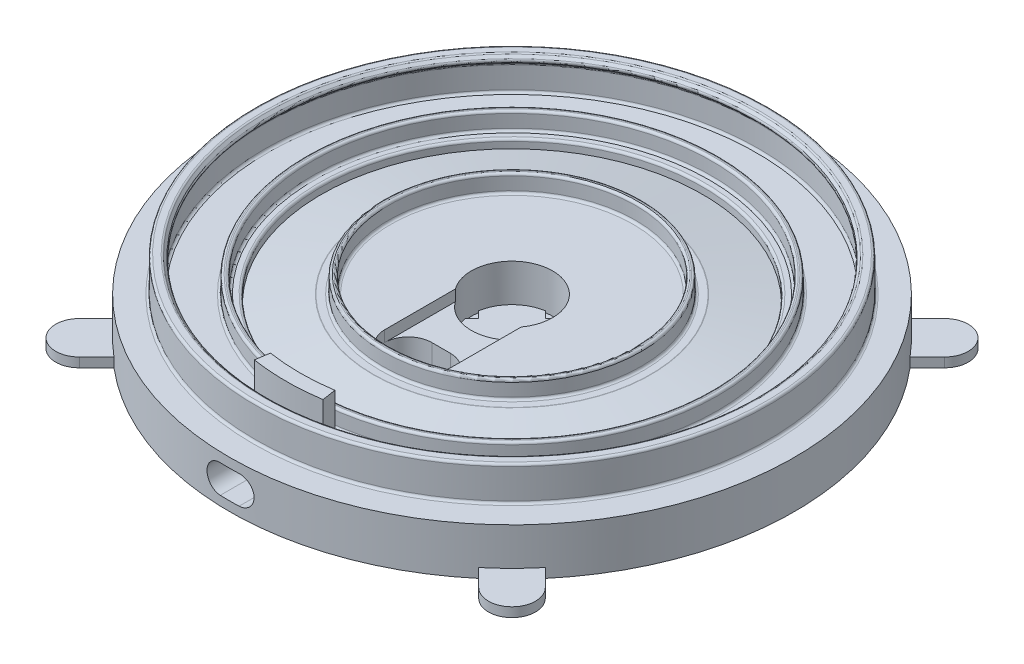
from build123d import *

# Parameters (mm, degrees)
SKETCH1_R               = 60
BOSS_EXTRUDE1_DEPTH     = 10
SKETCH3_R               = 43.75
SKETCH3_R_2             = 42.5
SKETCH3_R_3             = 27.5
SKETCH3_R_4             = 26.25
BOSS_EXTRUDE2_DEPTH     = 3.723
FILLET1_R               = 0.5
FILLET2_R               = 0.5
SKETCH6_R               = 8.625
CUT_EXTRUDE1_DEPTH      = 8.354
SKETCH9_W               = 14
SKETCH9_H               = 15
CUT_EXTRUDE2_DEPTH      = 2.354
CUT_EXTRUDE3_DEPTH      = 10
CUT_EXTRUDE4_DEPTH      = 2
CUT_EXTRUDE4_DEPTH_BACK = 40
BOSS_EXTRUDE3_DEPTH     = 2
BOSS_EXTRUDE4_DEPTH     = 8


with BuildPart() as part:
    # Sketch1 → Boss-Extrude1 (new body)
    with BuildSketch(Plane(origin=(0, 0, 0), x_dir=(1, 0, 0), z_dir=(0, 1, 0))):
        Circle(SKETCH1_R)
    extrude(amount=BOSS_EXTRUDE1_DEPTH)

    # Sketch2 → Cut-Revolve1 (revolve, cut)
    with BuildSketch(Plane.XY):
        Polygon((-29.5, 10), (-40.5, 8.127), (-40.5, 10), align=None)
    revolve(axis=Axis((0, 10, 0), (0, -1, 0)), mode=Mode.SUBTRACT)

    # Sketch3 → Boss-Extrude2 (add)
    # profile 1 of 2: a face of its own
    with BuildSketch(Plane(origin=(0, 10, 0), x_dir=(1, 0, 0), z_dir=(0, 1, 0))):
        Circle(SKETCH3_R)
        Circle(SKETCH3_R_2, mode=Mode.SUBTRACT)
    # profile 2 of 2: a face of its own
    with BuildSketch(Plane(origin=(0, 10, 0), x_dir=(1, 0, 0), z_dir=(0, 1, 0))):
        Circle(SKETCH3_R_3)
        Circle(SKETCH3_R_4, mode=Mode.SUBTRACT)
    extrude(amount=BOSS_EXTRUDE2_DEPTH)

    # Fillet1
    fillet1_edges = [part.edges().sort_by_distance(p)[0] for p in [
        (-26.25, 10, 0),
        (-27.5, 10, 0),
        (-43.75, 10, 0),
        (-42.5, 10, 0),
        (40.5, 10, 0),
        (-27.5, 13.723, 0),
        (-26.25, 13.723, 0),
        (-43.75, 13.723, 0),
        (-42.5, 13.723, 0),
        (29.5, 10, 0),
    ]]
    fillet(fillet1_edges, radius=FILLET1_R)

    # Sketch5 → Revolve1 (revolve)
    with BuildSketch(Plane.XY):
        Polygon((-52.5, 10), (-54.5, 10), (-54.5, 17.323), (-52.5, 17.323), (-51.5, 16.323), (-52.5, 15.323), align=None)
    revolve(axis=Axis((0, 10, 0), (0, 1, 0)))

    # Fillet2
    fillet2_edges = [part.edges().sort_by_distance(p)[0] for p in [
        (52.5, 10, 0),
        (52.5, 15.323, 0),
        (52.5, 17.323, 0),
        (51.5, 16.323, 0),
        (54.5, 10, 0),
        (54.5, 17.323, 0),
    ]]
    fillet(fillet2_edges, radius=FILLET2_R)

    # Sketch6 → Cut-Extrude1 (cut)
    with BuildSketch(Plane(origin=(0, 10, 0), x_dir=(1, 0, 0), z_dir=(0, 1, 0))):
        Circle(SKETCH6_R)
    extrude(amount=-CUT_EXTRUDE1_DEPTH, mode=Mode.SUBTRACT)

    # Sketch9 → Cut-Extrude2 (cut)
    with BuildSketch(Plane(origin=(0, 10, 0), x_dir=(1, 0, 0), z_dir=(0, 1, 0))):
        with Locations((0, -12.538911093)):
            Rectangle(SKETCH9_W, SKETCH9_H)
    extrude(amount=-CUT_EXTRUDE2_DEPTH, mode=Mode.SUBTRACT)

    # Sketch10 → Cut-Extrude3 (cut)
    with BuildSketch(Plane(origin=(0, 10, 0), x_dir=(1, 0, 0), z_dir=(0, 1, 0))):
        with BuildLine():
            Line((2, -25.038911093), (-2, -25.038911093))
            ThreePointArc((-2, -25.038911093), (-7, -20.038911093), (-2, -15.038911093))
            Line((-2, -15.038911093), (2, -15.038911093))
            ThreePointArc((2, -15.038911093), (7, -20.038911093), (2, -25.038911093))
        make_face()
    extrude(amount=-CUT_EXTRUDE3_DEPTH, mode=Mode.SUBTRACT)

    # Sketch11 → Cut-Extrude4 (cut, two sides: drawn at the far end of the back side and taken through both)
    with BuildSketch(Plane(origin=(0, 0, 25.038911093), x_dir=(-1, 0, 0), z_dir=(0, 0, -1)).offset(-CUT_EXTRUDE4_DEPTH_BACK)):
        with BuildLine():
            Line((-2, 8), (2, 8))
            ThreePointArc((2, 8), (5, 5), (2, 2))
            Line((2, 2), (-2, 2))
            ThreePointArc((-2, 2), (-5, 5), (-2, 8))
        make_face()
    extrude(amount=CUT_EXTRUDE4_DEPTH + CUT_EXTRUDE4_DEPTH_BACK, mode=Mode.SUBTRACT)

    # Sketch12 → Boss-Extrude3 (add)
    with BuildSketch(Plane.XZ):
        with BuildLine():
            Line((-49.497474683, -42.426406871), (42.426406871, 49.497474683))
            ThreePointArc((42.426406871, 49.497474683), (49.497474683, 49.497474683), (49.497474683, 42.426406871))
            Line((49.497474683, 42.426406871), (-42.426406871, -49.497474683))
            ThreePointArc((-42.426406871, -49.497474683), (-49.497474683, -49.497474683), (-49.497474683, -42.426406871))
        make_face()
        with BuildLine():
            Line((42.426406871, -49.497474683), (-49.497474683, 42.426406871))
            ThreePointArc((-49.497474683, 42.426406871), (-49.497474683, 49.497474683), (-42.426406871, 49.497474683))
            Line((-42.426406871, 49.497474683), (49.497474683, -42.426406871))
            ThreePointArc((49.497474683, -42.426406871), (49.497474683, -49.497474683), (42.426406871, -49.497474683))
        make_face()
    extrude(amount=-BOSS_EXTRUDE3_DEPTH)

    # Sketch13 → Boss-Extrude4 (add)
    with BuildSketch(Plane(origin=(0, 10, 0), x_dir=(1, 0, 0), z_dir=(0, 1, 0))):
        with BuildLine():
            Line((-7.301922537, -47.441352502), (-6.845552379, -44.476267971))
            ThreePointArc((-6.845552379, -44.476267971), (0, -45), (6.845552379, -44.476267971))
            Line((6.845552379, -44.476267971), (7.301922537, -47.441352502))
            ThreePointArc((7.301922537, -47.441352502), (0, -48), (-7.301922537, -47.441352502))
        make_face()
    extrude(amount=BOSS_EXTRUDE4_DEPTH)


solid = part.part
